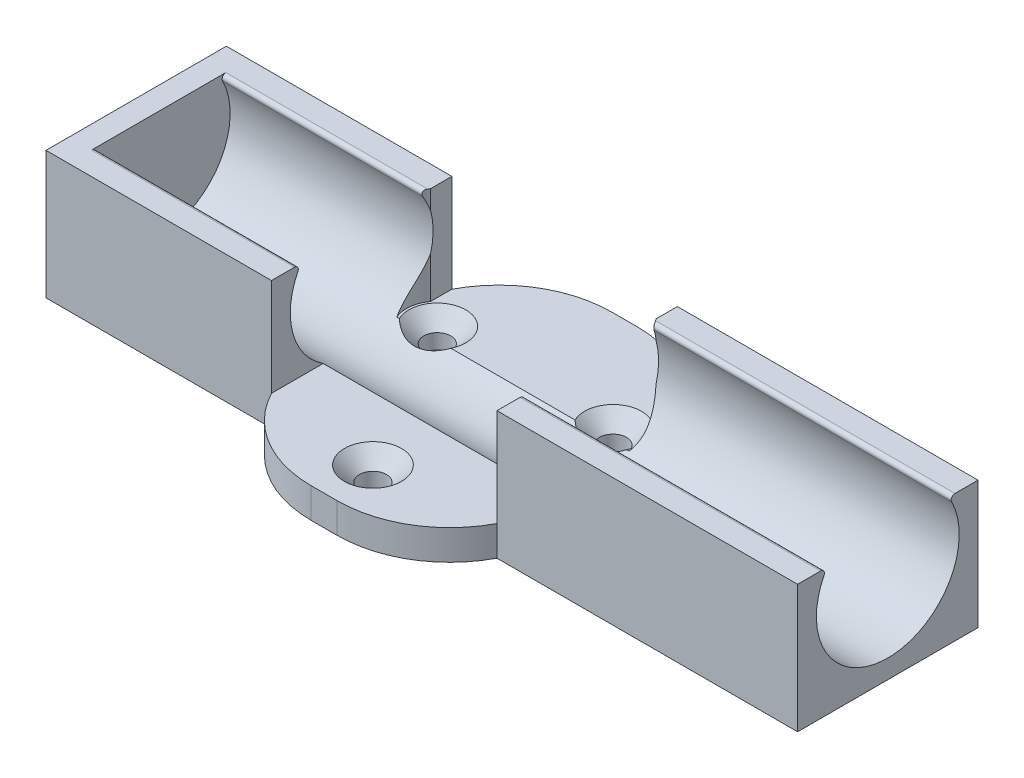
from build123d import *

# Parameters (mm, degrees)
EXTRUDE_2_DEPTH     = 4
SKETCH_7_W          = 100
SKETCH_7_H          = 24
EXTRUDE_3_DEPTH     = 13
SKETCH_8_R          = 9.5
CUT_EXTRUDE_3_DEPTH = 97
SKETCH_9_W          = 30
SKETCH_9_H          = 13
CUT_EXTRUDE_4_DEPTH = 79.822585596
SKETCH_10_R         = 1.8
CUT_EXTRUDE_5_DEPTH = 74.952687578
FILLET_3_R          = 15
FILLET_4_R          = 0.5
CUT_EXTRUDE_9_REACH = 76.76
SKETCH_11_R         = 4.1


with BuildPart() as part:
    # Эскиз6 → Бобышка-Вытянуть2 (new body)
    with BuildSketch(Plane(origin=(0, 0, 0), x_dir=(1, 0, 0), z_dir=(0, 1, 0))):
        Polygon((0, 20), (0, 12), (-30, 12), (-30, -12), (0, -12), (0, -20), (30, -20), (30, -12), (70, -12), (70, 12), (30, 12), (30, 20), align=None)
    extrude(amount=EXTRUDE_2_DEPTH)

    # Эскиз7 → Бобышка-Вытянуть3 (add)
    with BuildSketch(Plane(origin=(0, 4, 0), x_dir=(1, 0, 0), z_dir=(0, 1, 0))):
        with Locations((20, 0)):
            Rectangle(SKETCH_7_W, SKETCH_7_H)
    extrude(amount=EXTRUDE_3_DEPTH)

    # Эскиз8 → Вырез-Вытянуть3 (cut)
    with BuildSketch(Plane(origin=(70, 0, 0), x_dir=(0, 0, -1), z_dir=(1, 0, 0))):
        with Locations((0, 12)):
            Circle(SKETCH_8_R)
    extrude(amount=-CUT_EXTRUDE_3_DEPTH, mode=Mode.SUBTRACT)

    # Эскиз9 → Вырез-Вытянуть4 (cut, through all)
    with BuildSketch(Plane.XY.offset(12)):
        with Locations((15, 10.5)):
            Rectangle(SKETCH_9_W, SKETCH_9_H)
    extrude(amount=-CUT_EXTRUDE_4_DEPTH, mode=Mode.SUBTRACT)

    # Эскиз10 → Вырез-Вытянуть5 (cut, through all)
    with BuildSketch(Plane(origin=(0, 4, 0), x_dir=(1, 0, 0), z_dir=(0, 1, 0))):
        with Locations(Location((15, -13.5, 0), (0, 0, 270))):
            Circle(SKETCH_10_R)
        with Locations(Location((3.308657049, 6.75, 0), (0, 0, 270))):
            Circle(SKETCH_10_R)
        with Locations(Location((26.691342951, 6.75, 0), (0, 0, 270))):
            Circle(SKETCH_10_R)
    extrude(amount=-CUT_EXTRUDE_5_DEPTH, mode=Mode.SUBTRACT)

    # Скругление3
    # the kernel refuses this fillet: 15 mm, written as the material it takes off along each edge
    with BuildSketch(Plane(origin=(30, -33.166247904, -20), x_dir=(-1, 0, 0), z_dir=(0, 1, 0))) as fillet_3_piece_1:
        with BuildLine():
            CenterArc((13.266499161, 15), FILLET_3_R, 207.818139285, 62.181860715)
            Line((0, 8), (-0.265329983, 7.86))
            ThreePointArc((-0.265329983, 7.86), (-0.3, 4), (-0.3, 0))
            Line((-0.3, 0), (0, -0.3))
            Line((0, -0.3), (13.266499161, -0.3))
            Line((13.266499161, -0.3), (13.266499161, 0))
        make_face()
    extrude(amount=70.332495807, mode=Mode.SUBTRACT)
    with BuildSketch(Plane(origin=(0, -33.166247904, -20), x_dir=(0, 0, 1), z_dir=(0, 1, 0))) as fillet_3_piece_2:
        with BuildLine():
            CenterArc((15, 13.266499161), FILLET_3_R, 180, 62.181860715)
            Line((0, 13.266499161), (-0.3, 13.266499161))
            Line((-0.3, 13.266499161), (-0.3, 0))
            Line((-0.3, 0), (0, -0.3))
            ThreePointArc((0, -0.3), (4, -0.3), (7.86, -0.265329983))
            Line((7.86, -0.265329983), (8, 0))
        make_face()
    extrude(amount=70.332495807, mode=Mode.SUBTRACT)
    with BuildSketch(Plane(origin=(30, -33.166247904, 20), x_dir=(-1, 0, 0), z_dir=(0, 1, 0))) as fillet_3_piece_3:
        with BuildLine():
            CenterArc((13.266499161, -15), FILLET_3_R, 90, 62.181860715)
            Line((0, -8), (-0.265329983, -7.86))
            ThreePointArc((-0.265329983, -7.86), (-0.3, -4), (-0.3, 0))
            Line((-0.3, 0), (0, 0.3))
            Line((0, 0.3), (13.266499161, 0.3))
            Line((13.266499161, 0.3), (13.266499161, 0))
        make_face()
    extrude(amount=70.332495807, mode=Mode.SUBTRACT)
    with BuildSketch(Plane(origin=(0, -33.166247904, 20), x_dir=(0, 0, -1), z_dir=(0, 1, 0))) as fillet_3_piece_4:
        with BuildLine():
            CenterArc((15, -13.266499161), FILLET_3_R, 117.818139285, 62.181860715)
            Line((0, -13.266499161), (-0.3, -13.266499161))
            Line((-0.3, -13.266499161), (-0.3, 0))
            Line((-0.3, 0), (0, 0.3))
            ThreePointArc((0, 0.3), (4, 0.3), (7.86, 0.265329983))
            Line((7.86, 0.265329983), (8, 0))
        make_face()
    extrude(amount=70.332495807, mode=Mode.SUBTRACT)

    # Скругление4
    fillet_4_edges = [part.edges().sort_by_distance(p)[0] for p in [
        (50, 17, -8.077747211),
        (-13.5, 17, 8.077747211),
        (50, 17, 8.077747211),
        (-13.5, 17, -8.077747211),
    ]]
    fillet(fillet_4_edges, radius=FILLET_4_R)

    # Вырез-Вытянуть9: up to this face of the body (flat: up to its plane)
    cut_extrude_9_end = Plane(part.part.faces().sort_by_distance((15, 4, 11.690077791))[0])
    # Эскиз11 → Вырез-Вытянуть9 (cut, up to the picked face)
    with BuildSketch(Plane(origin=(0, 17, 0), x_dir=(1, 0, 0), z_dir=(0, 1, 0)), mode=Mode.PRIVATE) as cut_extrude_9_sk1:
        with Locations((15, -13.5)):
            Circle(SKETCH_11_R)
    cut_extrude_9_tool1 = split(extrude(cut_extrude_9_sk1.sketch, amount=-CUT_EXTRUDE_9_REACH, mode=Mode.PRIVATE), bisect_by=cut_extrude_9_end, keep=Keep.BOTH, mode=Mode.PRIVATE)
    # Эскиз11 → Вырез-Вытянуть9 (cut, up to the picked face)
    with BuildSketch(Plane(origin=(0, 17, 0), x_dir=(1, 0, 0), z_dir=(0, 1, 0)), mode=Mode.PRIVATE) as cut_extrude_9_sk2:
        with Locations((3.308657049, 6.75)):
            Circle(SKETCH_11_R)
    cut_extrude_9_tool2 = split(extrude(cut_extrude_9_sk2.sketch, amount=-CUT_EXTRUDE_9_REACH, mode=Mode.PRIVATE), bisect_by=cut_extrude_9_end, keep=Keep.BOTH, mode=Mode.PRIVATE)
    # Эскиз11 → Вырез-Вытянуть9 (cut, up to the picked face)
    with BuildSketch(Plane(origin=(0, 17, 0), x_dir=(1, 0, 0), z_dir=(0, 1, 0)), mode=Mode.PRIVATE) as cut_extrude_9_sk3:
        with Locations((26.691342951, 6.75)):
            Circle(SKETCH_11_R)
    cut_extrude_9_tool3 = split(extrude(cut_extrude_9_sk3.sketch, amount=-CUT_EXTRUDE_9_REACH, mode=Mode.PRIVATE), bisect_by=cut_extrude_9_end, keep=Keep.BOTH, mode=Mode.PRIVATE)
    add(cut_extrude_9_tool1.solids().sort_by(Axis((15, 17, 13.5), (0, -1, 0)))[0], mode=Mode.SUBTRACT)
    add(cut_extrude_9_tool2.solids().sort_by(Axis((3.308657, 17, -6.75), (0, -1, 0)))[0], mode=Mode.SUBTRACT)
    add(cut_extrude_9_tool3.solids().sort_by(Axis((26.691343, 17, -6.75), (0, -1, 0)))[0], mode=Mode.SUBTRACT)

    # Фаска2: read off the stored shape, not the designer's step
    # Фаска2 outline → Фаска2 (revolve, cut)
    with BuildSketch(Plane(origin=(26.691342951, 0, -6.75), x_dir=(1, 0, 0), z_dir=(0, 0, 1))):
        Polygon((1.8, 4.000001023), (1.8, 2), (3.800001023, 4.000001023), align=None)
    revolve(axis=Axis((26.691342951, 0, -6.75), (0, 1, 0)), mode=Mode.SUBTRACT)

    # Фаска1: read off the stored shape, not the designer's step
    # Фаска1: loft between two sections, ruled curve by curve
    chamfer_1_from = [
        Edge.make_three_point_arc((15, 2, 11.7), (13.2, 2, 13.5), (15, 2, 15.3)),
        Edge.make_three_point_arc((15, 2, 15.3), (16.8, 2, 13.5), (15, 2, 11.7)),
    ]
    chamfer_1_to = [
        Edge.make_three_point_arc((15, 4, 9.7), (11.2, 4, 13.5), (15, 4, 17.3)),
        Edge.make_three_point_arc((15, 4, 17.3), (18.8, 4, 13.5), (15, 4, 9.7)),
    ]
    chamfer_1 = Solid(Shell([*[Face.make_surface_from_curves(chamfer_1_from[k], chamfer_1_to[k]) for k in range(2)], Face(Wire(chamfer_1_from)), Face(Wire(chamfer_1_to))]))
    add(chamfer_1, mode=Mode.SUBTRACT)

    # Chamfer 1 2: loft between two sections, ruled curve by curve
    chamfer_1_2_from = [
        Edge.make_three_point_arc((4.935430815, 2, -5.979540971), (4.079116078, 2, -8.376773766), (1.681883283, 2, -7.520459029)),
        Edge.make_three_point_arc((1.681883283, 2, -7.520459029), (2.53819802, 2, -5.123226234), (4.935430815, 2, -5.979540971)),
    ]
    chamfer_1_2_to = [
        Edge.make_three_point_arc((6.742958145, 4.000001023, -5.123474945), (4.935182104, 4.000001023, -10.184301096), (-0.125644047, 4.000001023, -8.376525055)),
        Edge.make_three_point_arc((-0.125644047, 4.000001023, -8.376525055), (1.682131994, 4.000001023, -3.315698904), (6.742958145, 4.000001023, -5.123474945)),
    ]
    chamfer_1_2 = Solid(Shell([*[Face.make_surface_from_curves(chamfer_1_2_from[k], chamfer_1_2_to[k]) for k in range(2)], Face(Wire(chamfer_1_2_from)), Face(Wire(chamfer_1_2_to))]))
    add(chamfer_1_2, mode=Mode.SUBTRACT)


solid = part.part
